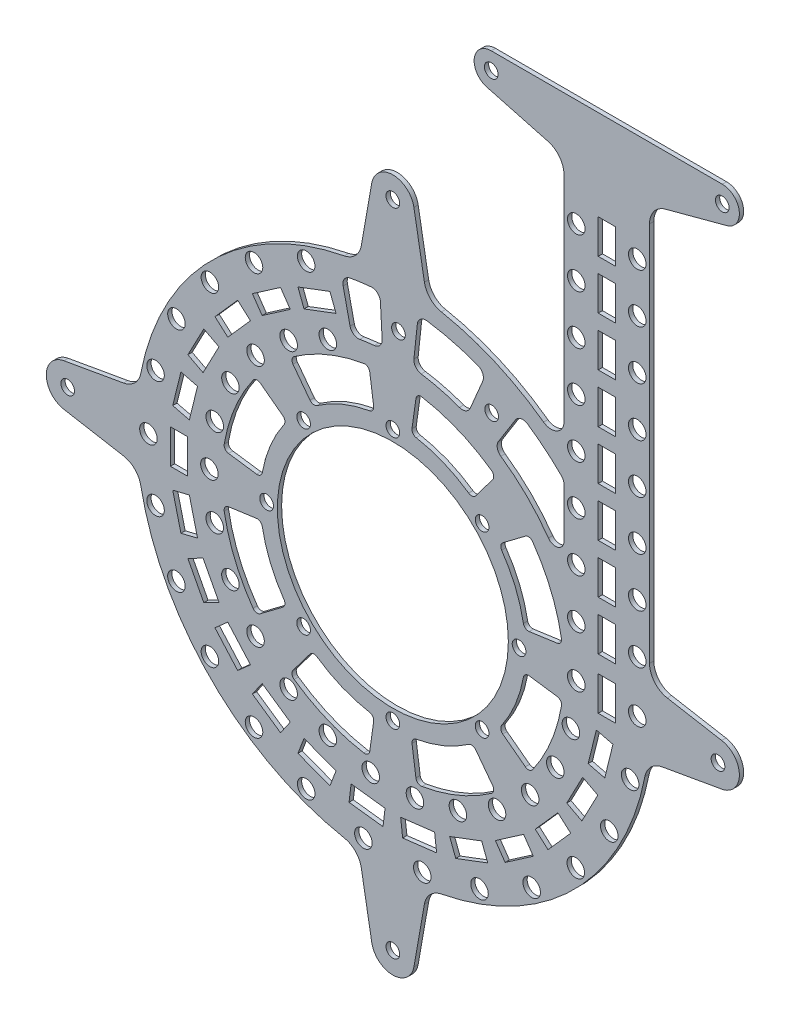
from build123d import *

# Parameters (mm, degrees)
SKETCH_1_W               = 200
SKETCH_1_H               = 300
EXTRUDE_1_DEPTH          = 1
SKETCH_2_OUTSIDE_W       = 274.112
SKETCH_2_OUTSIDE_H       = 374.112
CUT_EXTRUDE_1_DEPTH      = 10
SKETCH_3_R               = 27
CUT_EXTRUDE_2_DEPTH      = 10
SKETCH_4_R               = 1.6
CUT_EXTRUDE_3_DEPTH      = 10
SKETCH_5_R               = 1.6
CUT_EXTRUDE_4_DEPTH      = 10
PATTERN_CIRCULAR_1_COUNT = 8
SKETCH_6_W               = 4
SKETCH_6_H               = 8
CUT_EXTRUDE_5_DEPTH      = 10
PATTERN_CIRCULAR_2_COUNT = 26
SKETCH_7_W               = 4
SKETCH_7_H               = 8
CUT_EXTRUDE_6_DEPTH      = 10
PATTERN_LINEAR_1_COUNT   = 8
PATTERN_LINEAR_1_PITCH   = 11.5
EXTRUDE_START            = -1
EXTRUDE_2_DEPTH          = 1
SKETCH_9_R               = 2.05
CUT_EXTRUDE_7_DEPTH      = 10
PATTERN_CIRCULAR_3_COUNT = 26
SKETCH_10_R              = 2.05
CUT_EXTRUDE_8_DEPTH      = 10
PATTERN_LINEAR_2_COUNT   = 8
PATTERN_LINEAR_2_PITCH   = 11.5
SKETCH_11_R              = 1.6
CUT_EXTRUDE_9_DEPTH      = 10
CUT_EXTRUDE_10_DEPTH     = 10
FILLET_1_R               = 2


with BuildPart() as part:
    # 草图1 → 凸台-拉伸1 (new body)
    with BuildSketch(Plane.XY):
        Rectangle(SKETCH_1_W, SKETCH_1_H)
    extrude(amount=EXTRUDE_1_DEPTH)

    # 草图2 outside → 切除-拉伸1 (cut)
    with BuildSketch(Plane.XY.offset(1)):
        Rectangle(SKETCH_2_OUTSIDE_W, SKETCH_2_OUTSIDE_H)
        with BuildLine():
            Line((40, 101.064727818), (40, 50.990195136))
            ThreePointArc((40, 50.990195136), (38.362770288, 48.317582717), (35.238095238, 48.562090606))
            ThreePointArc((35.238095238, 48.562090606), (23.864678316, 55.049769562), (11.354741948, 58.91578596))
            ThreePointArc((11.354741948, 58.91578596), (8.73750949, 60.31805029), (7.376931679, 62.957193902))
            Line((7.376931679, 62.957193902), (4.924038765, 76.868240888))
            ThreePointArc((4.924038765, 76.868240888), (0, 81), (-4.924038765, 76.868240888))
            Line((-4.924038765, 76.868240888), (-7.376931679, 62.957193902))
            ThreePointArc((-7.376931679, 62.957193902), (-8.73750949, 60.31805029), (-11.354741948, 58.91578596))
            ThreePointArc((-11.354741948, 58.91578596), (-42.426406871, 42.426406871), (-58.91578596, 11.354741948))
            ThreePointArc((-58.91578596, 11.354741948), (-60.31805029, 8.73750949), (-62.957193902, 7.376931679))
            Line((-62.957193902, 7.376931679), (-76.868240888, 4.924038765))
            ThreePointArc((-76.868240888, 4.924038765), (-81, 0), (-76.868240888, -4.924038765))
            Line((-76.868240888, -4.924038765), (-62.957193902, -7.376931679))
            ThreePointArc((-62.957193902, -7.376931679), (-60.31805029, -8.73750949), (-58.91578596, -11.354741948))
            ThreePointArc((-58.91578596, -11.354741948), (-42.426406871, -42.426406871), (-11.354741948, -58.91578596))
            ThreePointArc((-11.354741948, -58.91578596), (-8.73750949, -60.31805029), (-7.376931679, -62.957193902))
            Line((-7.376931679, -62.957193902), (-4.924038765, -76.868240888))
            ThreePointArc((-4.924038765, -76.868240888), (0, -81), (4.924038765, -76.868240888))
            Line((4.924038765, -76.868240888), (7.376931679, -62.957193902))
            ThreePointArc((7.376931679, -62.957193902), (8.73750949, -60.31805029), (11.354741948, -58.91578596))
            ThreePointArc((11.354741948, -58.91578596), (42.426406871, -42.426406871), (58.91578596, -11.354741948))
            ThreePointArc((58.91578596, -11.354741948), (60.31805029, -8.73750949), (62.957193902, -7.376931679))
            Line((62.957193902, -7.376931679), (76.868240888, -4.924038765))
            ThreePointArc((76.868240888, -4.924038765), (81, 0), (76.868240888, 4.924038765))
            Line((76.868240888, 4.924038765), (64.131759112, 7.169824142))
            ThreePointArc((64.131759112, 7.169824142), (61.169777784, 8.879924858), (60, 12.093862907))
            Line((60, 12.093862907), (60, 101.064727818))
            ThreePointArc((60, 101.064727818), (61.033233299, 104.108534963), (63.705904774, 105.894356949))
            Line((63.705904774, 105.894356949), (78.03527618, 109.733900446))
            ThreePointArc((78.03527618, 109.733900446), (80.965779445, 114.11970852), (77, 117.597603751))
            Line((77, 117.597603751), (23, 117.597603751))
            ThreePointArc((23, 117.597603751), (19.034220555, 114.11970852), (21.96472382, 109.733900446))
            Line((21.96472382, 109.733900446), (36.294095226, 105.894356949))
            ThreePointArc((36.294095226, 105.894356949), (38.966766701, 104.108534963), (40, 101.064727818))
        make_face(mode=Mode.SUBTRACT)
    extrude(amount=-CUT_EXTRUDE_1_DEPTH, mode=Mode.SUBTRACT)

    # 草图3 → 切除-拉伸2 (cut)
    with BuildSketch(Plane.XY.offset(1)):
        Circle(SKETCH_3_R)
    extrude(amount=-CUT_EXTRUDE_2_DEPTH, mode=Mode.SUBTRACT)

    # 草图4 → 切除-拉伸3 (cut)
    with BuildSketch(Plane.XY.offset(1)):
        with Locations((76, 0)):
            Circle(SKETCH_4_R)
        with Locations((0, 76)):
            Circle(SKETCH_4_R)
        with Locations((-76, 0)):
            Circle(SKETCH_4_R)
        with Locations((0, -76)):
            Circle(SKETCH_4_R)
        with Locations((77, 113.597603751)):
            Circle(SKETCH_4_R)
        with Locations((23, 113.597603751)):
            Circle(SKETCH_4_R)
    extrude(amount=-CUT_EXTRUDE_3_DEPTH, mode=Mode.SUBTRACT)

    # 草图5 → 切除-拉伸4 (cut)
    with BuildSketch(Plane(origin=(0, 0, 0), x_dir=(-1, 0, 0), z_dir=(0, 0, -1))):
        with Locations((29.5, 0)):
            Circle(SKETCH_5_R)
        with BuildLine():
            Line((30.972234204, 23.339252525), (25.69819953, 19.364982337))
            ThreePointArc((25.69819953, 19.364982337), (25.235374749, 18.595744926), (25.435767214, 17.720658741))
            ThreePointArc((25.435767214, 17.720658741), (28.640265508, 11.863186403), (30.516201445, 5.455405519))
            ThreePointArc((30.516201445, 5.455405519), (30.993281949, 4.694927272), (31.86448148, 4.478260825))
            Line((31.86448148, 4.478260825), (38.404020562, 5.397333106))
            ThreePointArc((38.404020562, 5.397333106), (39.206429868, 5.878384948), (39.419600867, 6.789334833))
            ThreePointArc((39.419600867, 6.789334833), (36.9551813, 15.307337295), (32.674651785, 23.073082384))
            ThreePointArc((32.674651785, 23.073082384), (31.879778285, 23.566486567), (30.972234204, 23.339252525))
        make_face()
    cut_extrude_4 = extrude(amount=-CUT_EXTRUDE_4_DEPTH, mode=Mode.SUBTRACT)

    # 阵列(圆周)1: 切除-拉伸4 ×8 about axis
    pattern_circular_1_axis = Axis((0, 0, 0), (0, 0, 1))
    for i in range(1, PATTERN_CIRCULAR_1_COUNT):
        add(cut_extrude_4.rotate(pattern_circular_1_axis, i * 360 / PATTERN_CIRCULAR_1_COUNT), mode=Mode.SUBTRACT)

    # 草图6 → 切除-拉伸5 (cut)
    with BuildSketch(Plane.XY.offset(1)):
        with Locations((-50, 0)):
            Rectangle(SKETCH_6_W, SKETCH_6_H)
    cut_extrude_5 = extrude(amount=-CUT_EXTRUDE_5_DEPTH, mode=Mode.SUBTRACT)

    # 阵列(圆周)2: 切除-拉伸5 ×26 about axis, 3 skipped
    pattern_circular_2_axis = Axis((0, 0, 0), (0, 0, -1))
    add([cut_extrude_5.rotate(pattern_circular_2_axis, i * 360 / PATTERN_CIRCULAR_2_COUNT) for i in range(1, PATTERN_CIRCULAR_2_COUNT) if i not in (10, 11, 12)], mode=Mode.SUBTRACT)

    # 草图7 → 切除-拉伸6 (cut)
    with BuildSketch(Plane.XY.offset(1)):
        with Locations((50, 12)):
            Rectangle(SKETCH_7_W, SKETCH_7_H)
    cut_extrude_6 = extrude(amount=-CUT_EXTRUDE_6_DEPTH, mode=Mode.SUBTRACT)

    # 阵列(线性)1: 切除-拉伸6 ×8
    with Locations(*[(0, i * PATTERN_LINEAR_1_PITCH, 0) for i in range(1, PATTERN_LINEAR_1_COUNT)]):
        add(cut_extrude_6, mode=Mode.SUBTRACT)

    # 草图8 → 凸台-拉伸2 (add)
    with BuildSketch(Plane.XY.offset(1).offset(EXTRUDE_START)):
        with BuildLine():
            Line((-9.676875824, 38.811829051), (-14.515313736, 58.217743577))
            ThreePointArc((-14.515313736, 58.217743577), (14.006721831, 58.342195224), (39.363541739, 45.282574813))
            Line((39.363541739, 45.282574813), (26.24236116, 30.188383209))
            ThreePointArc((26.24236116, 30.188383209), (9.337814554, 38.894796816), (-9.676875824, 38.811829051))
        make_face()
    extrude(amount=EXTRUDE_2_DEPTH)

    # 草图9 → 切除-拉伸7 (cut)
    with BuildSketch(Plane.XY.offset(1)):
        with Locations((57.125, 0)):
            Circle(SKETCH_9_R)
        with Locations(Location((42.875, 0, 0), (0, 0, 180))):
            Circle(SKETCH_9_R)
    cut_extrude_7 = extrude(amount=-CUT_EXTRUDE_7_DEPTH, mode=Mode.SUBTRACT)

    # 阵列(圆周)3: 切除-拉伸7 ×26 about axis, 7 skipped
    pattern_circular_3_axis = Axis((0, 0, 0), (0, 0, 1))
    add([cut_extrude_7.rotate(pattern_circular_3_axis, i * 360 / PATTERN_CIRCULAR_3_COUNT) for i in range(1, PATTERN_CIRCULAR_3_COUNT) if i not in (1, 2, 3, 4, 5, 6, 7)], mode=Mode.SUBTRACT)

    # 草图10 → 切除-拉伸8 (cut)
    with BuildSketch(Plane.XY.offset(1)):
        with Locations((57.125, 12)):
            Circle(SKETCH_10_R)
        with Locations((42.875, 12)):
            Circle(SKETCH_10_R)
    cut_extrude_8 = extrude(amount=-CUT_EXTRUDE_8_DEPTH, mode=Mode.SUBTRACT)

    # 阵列(线性)2: 切除-拉伸8 ×8
    with Locations(*[(0, i * PATTERN_LINEAR_2_PITCH, 0) for i in range(1, PATTERN_LINEAR_2_COUNT)]):
        add(cut_extrude_8, mode=Mode.SUBTRACT)

    # 草图11 → 切除-拉伸9 (cut)
    with BuildSketch(Plane.XY.offset(1)):
        with Locations((23.087430662, 44.350541659)):
            Circle(SKETCH_11_R)
        with Locations((1.308847415, 49.982866249)):
            Circle(SKETCH_11_R)
    extrude(amount=-CUT_EXTRUDE_9_DEPTH, mode=Mode.SUBTRACT)

    # 草图12 → 切除-拉伸10 (cut)
    with BuildSketch(Plane(origin=(0, 0, 0), x_dir=(-1, 0, 0), z_dir=(0, 0, -1))):
        with BuildLine():
            Line((-40, 39.191835885), (-40, 19.5))
            ThreePointArc((-40, 19.5), (-33.095743502, 29.747634563), (-23.63971331, 37.701643925))
            Line((-23.63971331, 37.701643925), (-29.748852704, 47.444765389))
            ThreePointArc((-29.748852704, 47.444765389), (-35.117706712, 43.620484583), (-40, 39.191835885))
        make_face()
        with BuildLine():
            Line((3.017254149, 55.918656792), (2.397639458, 44.435361201))
            ThreePointArc((2.397639458, 44.435361201), (6.009803704, 44.092315197), (9.582012623, 43.456127693))
            Line((9.582012623, 43.456127693), (12.058263076, 54.68636294))
            ThreePointArc((12.058263076, 54.68636294), (7.562899043, 55.48695845), (3.017254149, 55.918656792))
        make_face()
        with BuildLine():
            Line((-21.801235639, 51.582032963), (-17.324196178, 40.989294051))
            ThreePointArc((-17.324196178, 40.989294051), (-11.14191018, 43.082569997), (-4.719920696, 44.248981329))
            Line((-4.719920696, 44.248981329), (-5.939675482, 55.684111335))
            ThreePointArc((-5.939675482, 55.684111335), (-14.021280227, 54.216267861), (-21.801235639, 51.582032963))
        make_face()
    extrude(amount=-CUT_EXTRUDE_10_DEPTH, mode=Mode.SUBTRACT)

    # 圆角1
    fillet_1_edges = [part.edges().sort_by_distance(p)[0] for p in [
        (40, 39.191835885, 0.5),
        (29.748852704, 47.444765389, 0.5),
        (23.63971331, 37.701643925, 0.5),
        (40, 19.5, 0.5),
        (-9.582012623, 43.456127693, 0.5),
        (-2.397639458, 44.435361201, 0.5),
        (-3.017254149, 55.918656792, 0.5),
        (-12.058263076, 54.68636294, 0.5),
        (4.719920696, 44.248981329, 0.5),
        (17.324196178, 40.989294051, 0.5),
        (21.801235639, 51.582032963, 0.5),
        (5.939675482, 55.684111335, 0.5),
    ]]
    fillet(fillet_1_edges, radius=FILLET_1_R)


solid = part.part
